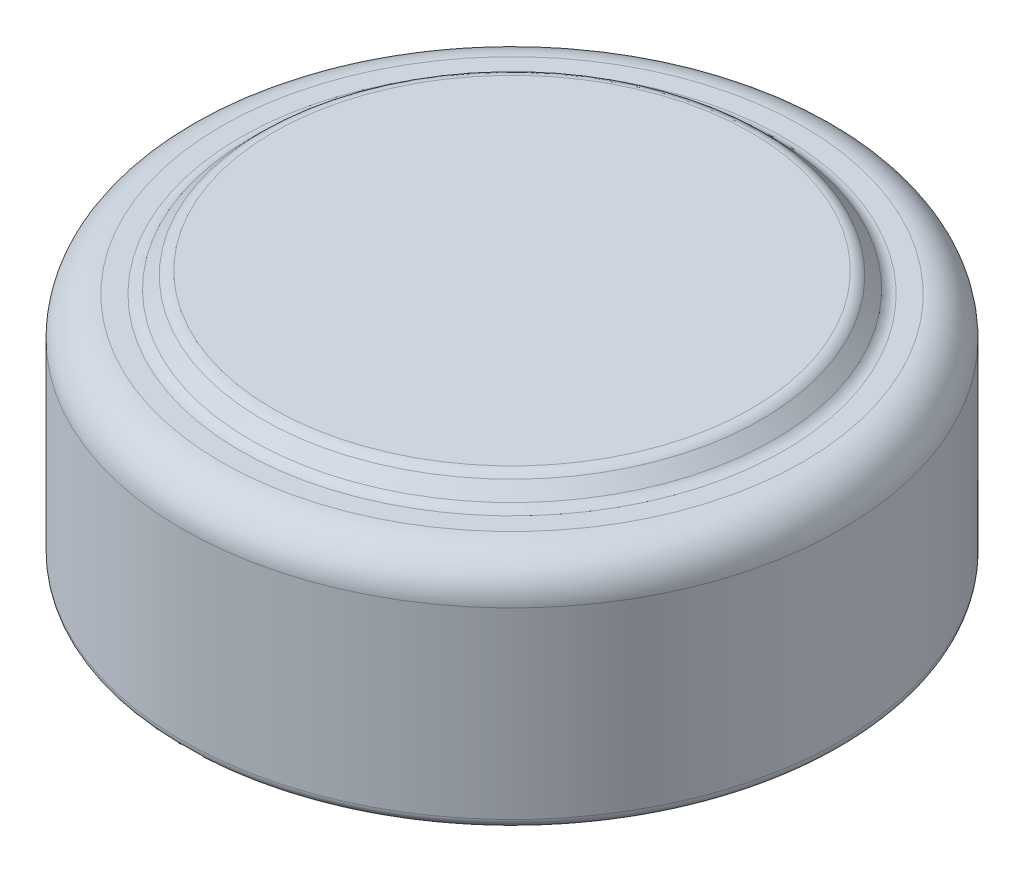
from build123d import *


with BuildPart() as part:
    # Sketch1 → Revolve1 (revolve)
    with BuildSketch(Plane.XY):
        with BuildLine():
            Line((0, 0), (-3.3, 0))
            ThreePointArc((-3.3, 0), (-3.370710678, 0.029289322), (-3.4, 0.1))
            Line((-3.4, 0.1), (-3.4, 1.99))
            ThreePointArc((-3.4, 1.99), (-3.282842712, 2.272842712), (-3, 2.39))
            Line((-3, 2.39), (-2.802132034, 2.39))
            ThreePointArc((-2.802132034, 2.39), (-2.74472952, 2.40141807), (-2.696066017, 2.433933983))
            Line((-2.696066017, 2.433933983), (-2.573933983, 2.556066017))
            ThreePointArc((-2.573933983, 2.556066017), (-2.52527048, 2.58858193), (-2.467867966, 2.6))
            Line((-2.467867966, 2.6), (0, 2.6))
            Line((0, 2.6), (0, 0))
        make_face()
    revolve(axis=Axis((0, 2.6, 0), (0, -1, 0)))


solid = part.part
